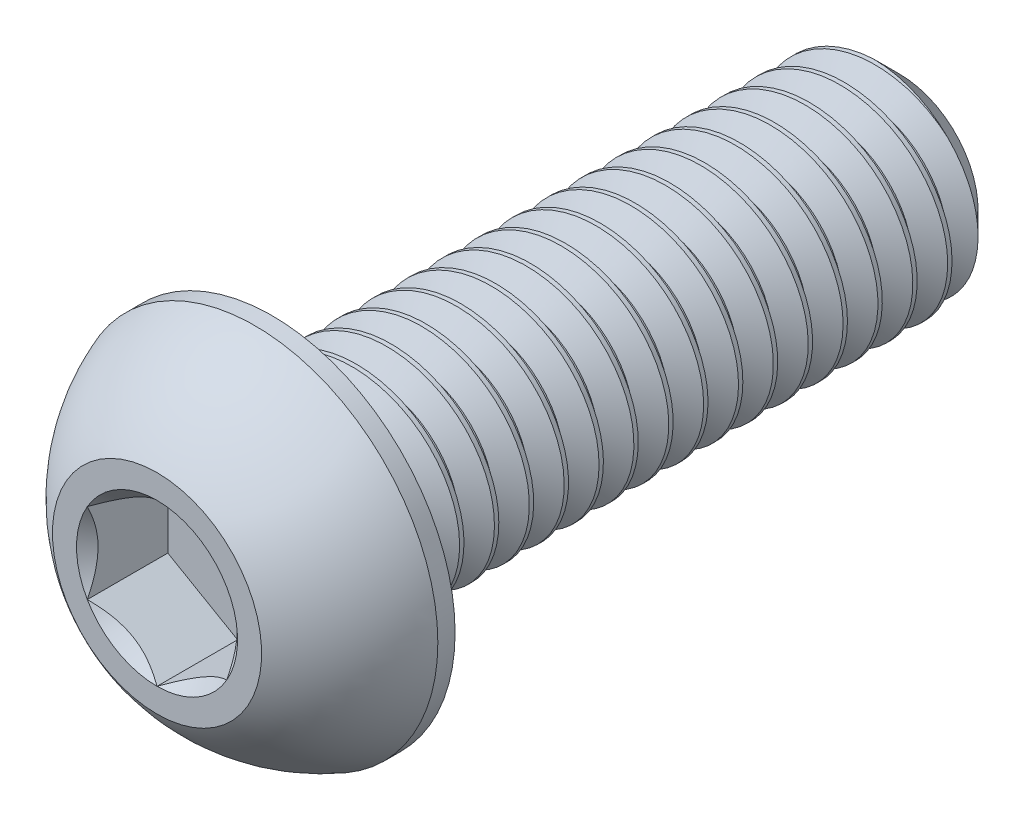
from build123d import *

# Parameters (mm, degrees)
SKETCH1_W          = 18
SKETCH1_H          = 3
CHAMFER1_SIZE      = 0.75
CUT_EXTRUDE2_DEPTH = 2.31
CUT_SWEEP1_PITCH   = 1


with BuildPart() as part:
    # Sketch1 → Revolve1 (revolve)
    with BuildSketch(Plane(origin=(0, 0, 0), x_dir=(0, 0, -1), z_dir=(1, 0, 0))):
        with Locations((12.3, 1.5)):
            Rectangle(SKETCH1_W, SKETCH1_H)
    revolve(axis=Axis((0, 0, -21.3), (0, 0, 1)))

    # Chamfer1
    chamfer1_edges = [part.edges().sort_by_distance(p)[0] for p in [
        (0, -3, -21.3),
    ]]
    chamfer(chamfer1_edges, length=CHAMFER1_SIZE)

    # Sketch7 → Revolve2 (revolve)
    with BuildSketch(Plane(origin=(0, 0, 0), x_dir=(0, 0, -1), z_dir=(1, 0, 0)), mode=Mode.PRIVATE) as revolve2_sk:
        with BuildLine():
            Line((2.805, 5.25), (3.3, 5.25))
            Line((3.3, 5.25), (3.3, 0))
            Line((3.3, 0), (0, 0))
            Line((0, 0), (0, 3))
            ThreePointArc((0, 3), (1.216479019, 4.356906156), (2.805, 5.25))
        make_face()
    revolve(revolve2_sk.sketch.rotate(Axis((0, 0, 0), (0, 0, -1)), 180), axis=Axis((0, 0, 0), (0, 0, -1)))

    # Sketch5 → Cut-Extrude2 (cut)
    with BuildSketch(Plane.XY):
        Polygon((2, -1.154700538), (2, 1.154700538), (0, 2.309401077), (-2, 1.154700538), (-2, -1.154700538), (0, -2.309401077), align=None)
    extrude(amount=-CUT_EXTRUDE2_DEPTH, mode=Mode.SUBTRACT)

    # Cut-Extrude3 cone 1 section (through the dimple's axis) → Cut-Extrude3 (revolve, cut)
    with BuildSketch(Plane(origin=(0, 0, 0), x_dir=(0, -1, 0), z_dir=(1, 0, 0))):
        Polygon((0, 0), (2.309401077, 0), (0, 2.309401077), align=None)
    revolve(axis=Axis((0, 0, 0), (0, 0, -1)), mode=Mode.SUBTRACT)

    # Cut-Sweep1: the profile of Sketch2 profile screwed along a right-hand helix of 19 turns, 8 arcs to a turn; built about Z, then put on its axis
    cut_sweep1_z = Axis((0, 0, 0), (0, 0, 1))
    cut_sweep1_corners = [(3.0003, 0, 0.750173205), (3.0003, 0, -0.125173205), (2.350480947, 0, 0.25), (2.350480947, 0, 0.375)]
    with BuildLine(mode=Mode.PRIVATE) as cut_sweep1_profile:
        Line(cut_sweep1_corners[0], cut_sweep1_corners[1])
        Line(cut_sweep1_corners[1], cut_sweep1_corners[2])
        Line(cut_sweep1_corners[2], cut_sweep1_corners[3])
        Line(cut_sweep1_corners[3], cut_sweep1_corners[0])
    cut_sweep1_cap = Face(cut_sweep1_profile.wire())
    cut_sweep1_turn_angles = [0, 22.5, 45, 67.5, 90, 112.5, 135, 157.5, 180, 202.5, 225, 247.5, 270, 292.5, 315, 337.5, 360]
    cut_sweep1_turn_weights = [1, 0.9238795325112867, 1, 0.9238795325112867, 1, 0.9238795325112867, 1, 0.9238795325112867, 1, 0.9238795325112867, 1, 0.9238795325112867, 1, 0.9238795325112867, 1, 0.9238795325112867, 1]
    cut_sweep1_turn_rails = [Edge.make_bspline([Vector(p[0], p[1], 0).rotate(cut_sweep1_z, cut_sweep1_turn_angles[k]) / cut_sweep1_turn_weights[k] + Vector(0, 0, p[2] + CUT_SWEEP1_PITCH * cut_sweep1_turn_angles[k] / 360) for k in range(17)], [0, 0, 0, 1, 1, 2, 2, 3, 3, 4, 4, 5, 5, 6, 6, 7, 7, 8, 8, 8], 2, cut_sweep1_turn_weights) for p in cut_sweep1_corners]
    cut_sweep1_turn_sides = [Face.make_surface_from_curves(cut_sweep1_turn_rails[p[0]], cut_sweep1_turn_rails[p[1]]) for p in [(0, 1), (1, 2), (2, 3), (3, 0)]]
    cut_sweep1 = Plane(origin=(0, 0, -21.3), x_dir=(0, 1, 0), z_dir=(0, 0, 1)) * Solid(Shell([*[p.moved(Location((0, 0, CUT_SWEEP1_PITCH * i))) for i in range(19) for p in cut_sweep1_turn_sides], cut_sweep1_cap, cut_sweep1_cap.rotate(cut_sweep1_z, 6840).moved(Location((0, 0, CUT_SWEEP1_PITCH * 6840 / 360)))]))
    add(cut_sweep1, mode=Mode.SUBTRACT)


solid = part.part
